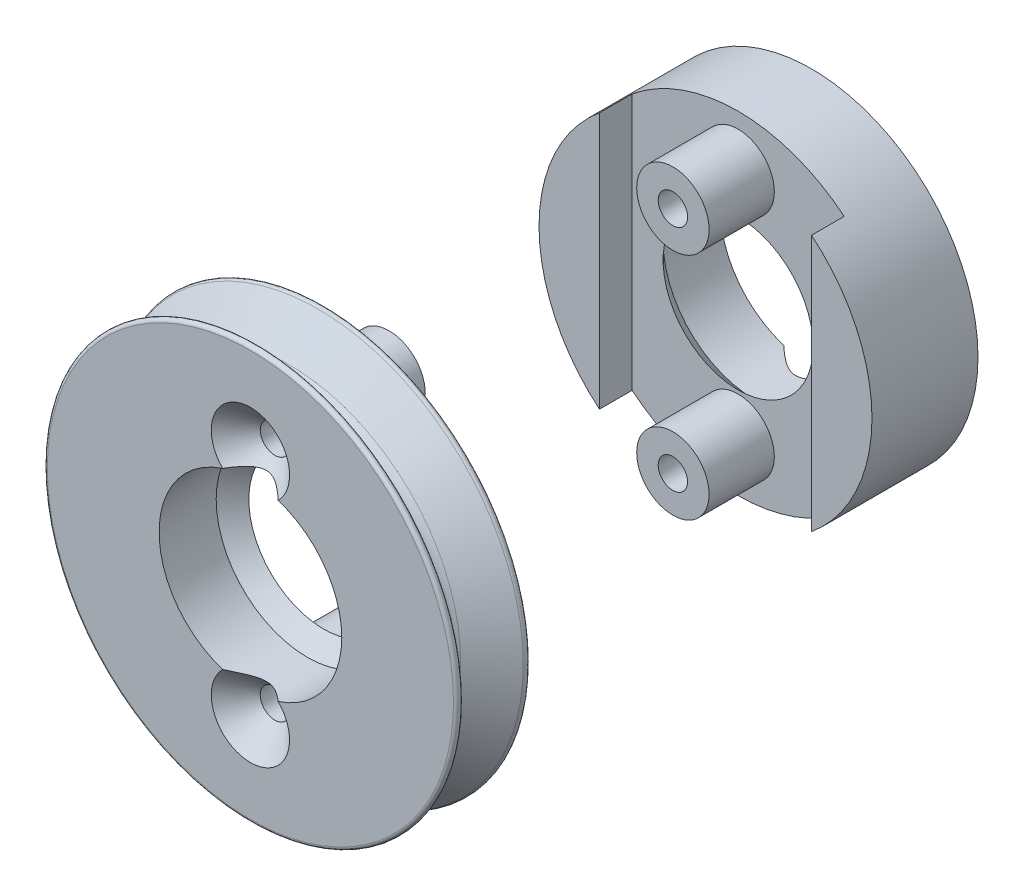
from build123d import *
from build123d.topology import SkipClean

# Parameters (mm, degrees)
SKETCH3_R           = 4.4375
BOSS_EXTRUDE1_DEPTH = 8
SKETCH4_R           = 1.8
CUT_EXTRUDE1_DEPTH  = 40.614519446
CHAMFER1_SIZE       = 3
SKETCH8_R           = 31.218050182
SKETCH8_R_2         = 20.4125
CUT_EXTRUDE3_DEPTH  = 25
BOSS_EXTRUDE4_DEPTH = 4


with BuildPart() as part:
    # Sketch2 → Revolve1 (revolve)
    with BuildSketch(Plane(origin=(0, 0, 0), x_dir=(0, 0, -1), z_dir=(1, 0, 0)), mode=Mode.PRIVATE) as revolve1_sk:
        with BuildLine():
            Line((-2, 11.2), (-9, 11.2))
            Line((-9, 11.2), (-9, 24.901285943))
            ThreePointArc((-9, 24.901285943), (-8.669459271, 25.295209045), (-8.224122952, 25.038094001))
            Line((-8.224122952, 25.038094001), (-6.920726988, 21.457043022))
            ThreePointArc((-6.920726988, 21.457043022), (-5.704631435, 20.436617692), (-4.212869399, 20.97957467))
            Line((-4.212869399, 20.97957467), (-0.706417777, 25.158400987))
            ThreePointArc((-0.706417777, 25.158400987), (-0.263191943, 25.277162992), (0, 24.901285943))
            Line((0, 24.901285943), (0, 9.2))
            Line((0, 9.2), (-2, 11.2))
        make_face()
    revolve(revolve1_sk.sketch.rotate(Axis((0, 0, 0), (0, 0, -1)), 90), axis=Axis((0, 0, 0), (0, 0, -1)))

    # Sketch3 → Boss-Extrude1 (add)
    with BuildSketch(Plane(origin=(0, 0, 0), x_dir=(-1, 0, 0), z_dir=(0, 0, -1))):
        with Locations(Location((0, 14.0625, 0), (0, 0, 180))):
            Circle(SKETCH3_R)
        with Locations(Location((0, -14.0625, 0), (0, 0, 180))):
            Circle(SKETCH3_R)
    extrude(amount=BOSS_EXTRUDE1_DEPTH)

    # Sketch4 → Cut-Extrude1 (cut, through all)
    with BuildSketch(Plane(origin=(0, 0, -8), x_dir=(-1, 0, 0), z_dir=(0, 0, -1))):
        with Locations((0, 14.0625)):
            Circle(SKETCH4_R)
        with Locations((0, -14.0625)):
            Circle(SKETCH4_R)
    extrude(amount=-CUT_EXTRUDE1_DEPTH, mode=Mode.SUBTRACT)

    # Chamfer1
    # the kernel refuses this chamfer: 3 mm, written as the material it takes off along each edge
    with BuildSketch(Plane(origin=(0, 14.0625, 9), x_dir=(-1, 0, 0), z_dir=(0, -1, 0))) as chamfer1_piece_1:
        Polygon((1.8 + CHAMFER1_SIZE, 0), (1.8, CHAMFER1_SIZE), (1.8, 0), align=None)
    revolve(axis=Axis((0, 14.0625, 9), (0, 0, -1)), mode=Mode.SUBTRACT)
    with BuildSketch(Plane(origin=(0, -14.0625, 9), x_dir=(-1, 0, 0), z_dir=(0, -1, 0))) as chamfer1_piece_2:
        Polygon((1.8 + CHAMFER1_SIZE, 0), (1.8, CHAMFER1_SIZE), (1.8, 0), align=None)
    revolve(axis=Axis((0, -14.0625, 9), (0, 0, -1)), mode=Mode.SUBTRACT)


with BuildPart() as body_2:
    # Mirror2: mirrored copy
    add(part.part.mirror(Plane(origin=(0, 0, -25.4), x_dir=(1, 0, 0), z_dir=(0, 0, -1))))

    # Sketch8 → Cut-Extrude3 (cut)
    with BuildSketch(Plane(origin=(0, 0, -59.8), x_dir=(-1, 0, 0), z_dir=(0, 0, -1))):
        Circle(SKETCH8_R)
        Circle(SKETCH8_R_2, mode=Mode.SUBTRACT)
    extrude(amount=-CUT_EXTRUDE3_DEPTH, mode=Mode.SUBTRACT)

    # Sketch9 → Boss-Extrude4 (add)
    with SkipClean():  # the faces are left unmerged after this step: merging them gives an invalid solid
        with BuildSketch(Plane.XY.offset(-50.8)):
            with BuildLine():
                ThreePointArc((-13, 15.737539714), (-20.4125, 0), (-13, -15.737539714))
                Line((-13, -15.737539714), (-13, 15.737539714))
            make_face()
            with BuildLine():
                Line((13, 15.737539714), (13, -15.737539714))
                ThreePointArc((13, -15.737539714), (18.466627416, -8.697920908), (20.4125, 0))
                ThreePointArc((20.4125, 0), (18.466627416, 8.697920908), (13, 15.737539714))
            make_face()
        extrude(amount=BOSS_EXTRUDE4_DEPTH)


solid = Compound([part.part, body_2.part])
